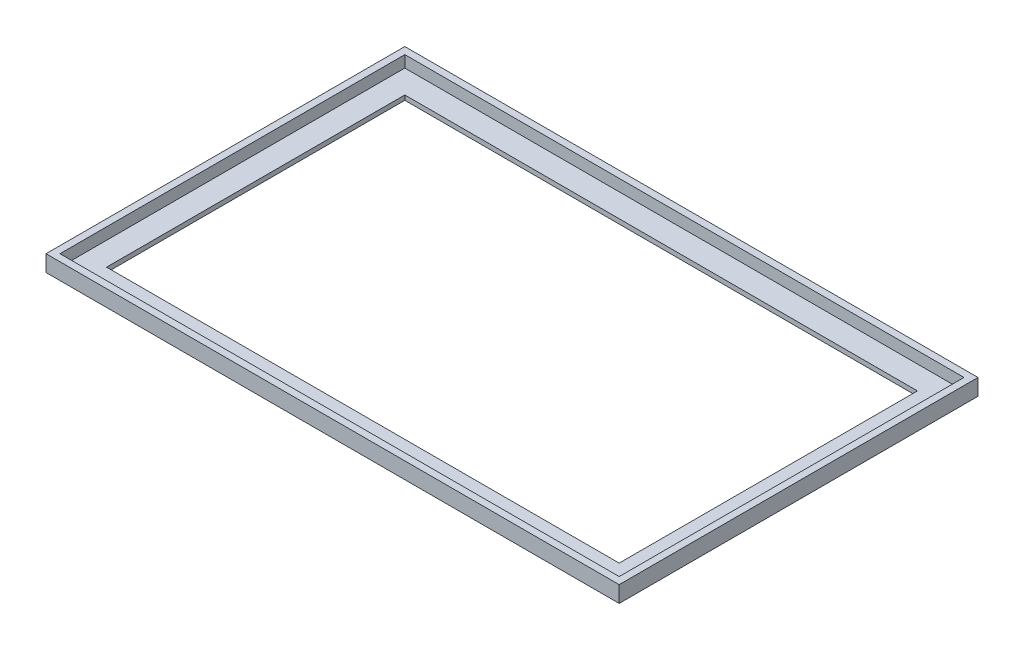
from build123d import *

# Parameters (mm, degrees)
SKETCH1_W           = 246
SKETCH1_H           = 154
BOSS_EXTRUDE1_DEPTH = 7
SKETCH2_W           = 240
SKETCH2_H           = 148
CUT_EXTRUDE1_DEPTH  = 5
SKETCH3_W           = 220
SKETCH3_H           = 128
CUT_EXTRUDE2_DEPTH  = 5
SKETCH8_W           = 39
SKETCH8_H           = 0.3
SKETCH8_W_2         = 12.26
CUT_EXTRUDE5_DEPTH  = 5
SKETCH9_R           = 0.5
CUT_EXTRUDE6_DEPTH  = 5


with BuildPart() as part:
    # Sketch1 → Boss-Extrude1 (new body)
    with BuildSketch(Plane(origin=(0, 0, 0), x_dir=(1, 0, 0), z_dir=(0, 1, 0))):
        Rectangle(SKETCH1_W, SKETCH1_H)
    extrude(amount=-BOSS_EXTRUDE1_DEPTH)

    # Sketch2 → Cut-Extrude1 (cut)
    with BuildSketch(Plane(origin=(0, 0, 0), x_dir=(1, 0, 0), z_dir=(0, 1, 0))):
        Rectangle(SKETCH2_W, SKETCH2_H)
    extrude(amount=-CUT_EXTRUDE1_DEPTH, mode=Mode.SUBTRACT)

    # Sketch3 → Cut-Extrude2 (cut)
    with BuildSketch(Plane(origin=(0, -5, 0), x_dir=(1, 0, 0), z_dir=(0, 1, 0))):
        Rectangle(SKETCH3_W, SKETCH3_H)
    extrude(amount=-CUT_EXTRUDE2_DEPTH, mode=Mode.SUBTRACT)

    # Sketch8 → Cut-Extrude5 (cut)
    with BuildSketch(Plane(origin=(0, -5, 0), x_dir=(1, 0, 0), z_dir=(0, 1, 0))):
        with Locations((0.5, -72.95)):
            Rectangle(SKETCH8_W, SKETCH8_H)
        with Locations((-36.13, -72.95)):
            Rectangle(SKETCH8_W_2, SKETCH8_H)
    extrude(amount=-CUT_EXTRUDE5_DEPTH, mode=Mode.SUBTRACT)

    # Sketch9 → Cut-Extrude6 (cut)
    with BuildSketch(Plane(origin=(0, -5, 0), x_dir=(1, 0, 0), z_dir=(0, 1, 0))):
        with Locations((119, -46.2)):
            Circle(SKETCH9_R)
        with Locations((119, -42.7)):
            Circle(SKETCH9_R)
    extrude(amount=-CUT_EXTRUDE6_DEPTH, mode=Mode.SUBTRACT)


solid = part.part
